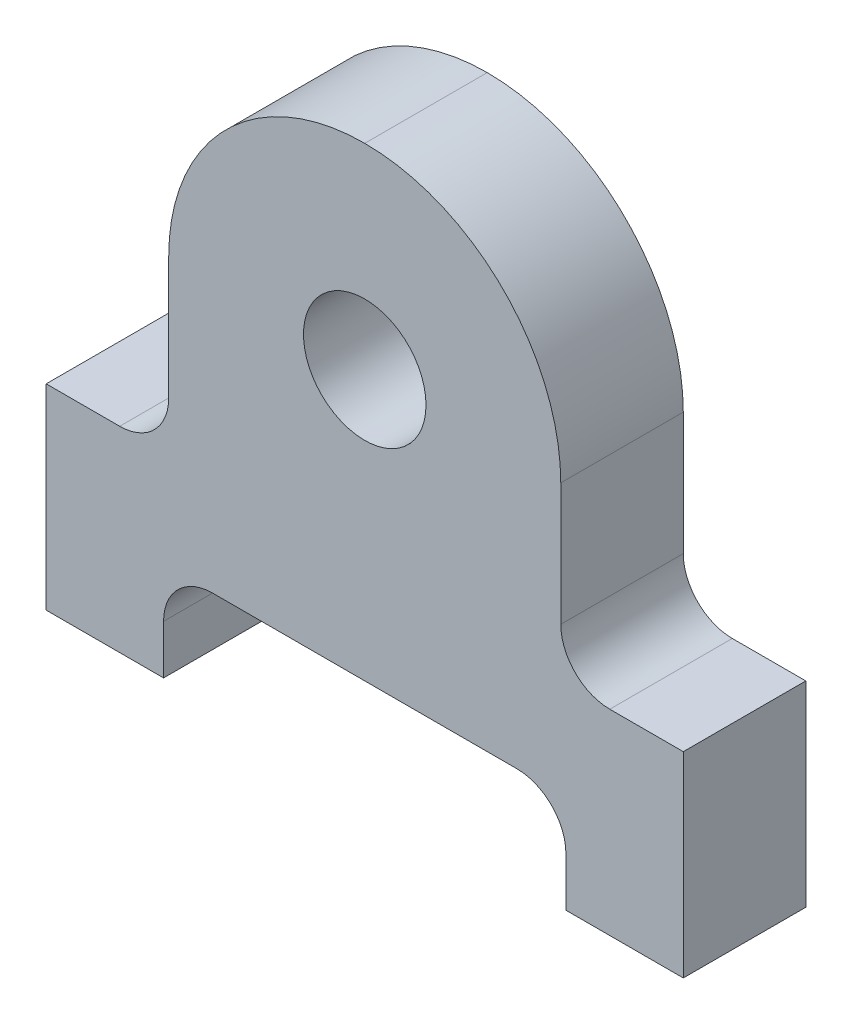
from build123d import *

# Parameters (mm, degrees)
SKETCH1_W           = 33.02
SKETCH1_H           = 29.21
BOSS_EXTRUDE1_DEPTH = 6.35
CUT_EXTRUDE1_REACH  = 24.939
SKETCH3_R           = 3.175
SKETCH3_W           = 6.35
SKETCH3_H           = 19.05
SKETCH3_W_2         = 20.8534
SKETCH3_H_2         = 5.08
FILLET1_R           = 10.16
FILLET2_R           = 2.54


with BuildPart() as part:
    # Sketch1 → Boss-Extrude1 (new body)
    with BuildSketch(Plane.XY):
        Rectangle(SKETCH1_W, SKETCH1_H)
    extrude(amount=BOSS_EXTRUDE1_DEPTH)

    # Sketch3 → Cut-Extrude1 (cut, up to next)
    with BuildSketch(Plane.XY.offset(6.35), mode=Mode.PRIVATE) as cut_extrude1_sk1:
        with Locations((0, 4.445)):
            Circle(SKETCH3_R)
    cut_extrude1_tool1 = extrude(cut_extrude1_sk1.sketch, amount=-CUT_EXTRUDE1_REACH, mode=Mode.PRIVATE) & part.part
    # Sketch3 → Cut-Extrude1 (cut, up to next)
    with BuildSketch(Plane.XY.offset(6.35), mode=Mode.PRIVATE) as cut_extrude1_sk2:
        with Locations((-13.335, 5.08)):
            Rectangle(SKETCH3_W, SKETCH3_H)
    cut_extrude1_tool2 = extrude(cut_extrude1_sk2.sketch, amount=-CUT_EXTRUDE1_REACH, mode=Mode.PRIVATE) & part.part
    # Sketch3 → Cut-Extrude1 (cut, up to next)
    with BuildSketch(Plane.XY.offset(6.35), mode=Mode.PRIVATE) as cut_extrude1_sk3:
        with Locations((13.335, 5.08)):
            Rectangle(SKETCH3_W, SKETCH3_H)
    cut_extrude1_tool3 = extrude(cut_extrude1_sk3.sketch, amount=-CUT_EXTRUDE1_REACH, mode=Mode.PRIVATE) & part.part
    # Sketch3 → Cut-Extrude1 (cut, up to next)
    with BuildSketch(Plane.XY.offset(6.35), mode=Mode.PRIVATE) as cut_extrude1_sk4:
        with Locations((0, -12.065)):
            Rectangle(SKETCH3_W_2, SKETCH3_H_2)
    cut_extrude1_tool4 = extrude(cut_extrude1_sk4.sketch, amount=-CUT_EXTRUDE1_REACH, mode=Mode.PRIVATE) & part.part
    add(cut_extrude1_tool1.solids().sort_by_distance((0, 4.445, 6.35))[0], mode=Mode.SUBTRACT)
    add(cut_extrude1_tool2.solids().sort_by_distance((-13.335, 5.08, 6.35))[0], mode=Mode.SUBTRACT)
    add(cut_extrude1_tool3.solids().sort_by_distance((13.335, 5.08, 6.35))[0], mode=Mode.SUBTRACT)
    add(cut_extrude1_tool4.solids().sort_by_distance((0, -12.065, 6.35))[0], mode=Mode.SUBTRACT)

    # Fillet1
    fillet1_edges = [part.edges().sort_by_distance(p)[0] for p in [
        (10.16, 14.605, 3.175),
        (-10.16, 14.605, 3.175),
    ]]
    fillet(fillet1_edges, radius=FILLET1_R - 0.0001)  # a hair under: the kernel refuses the full size

    # Fillet2
    fillet2_edges = [part.edges().sort_by_distance(p)[0] for p in [
        (10.16, -4.445, 3.175),
        (-10.4267, -9.525, 3.175),
        (10.4267, -9.525, 3.175),
        (-10.16, -4.445, 3.175),
    ]]
    fillet(fillet2_edges, radius=FILLET2_R)


solid = part.part
